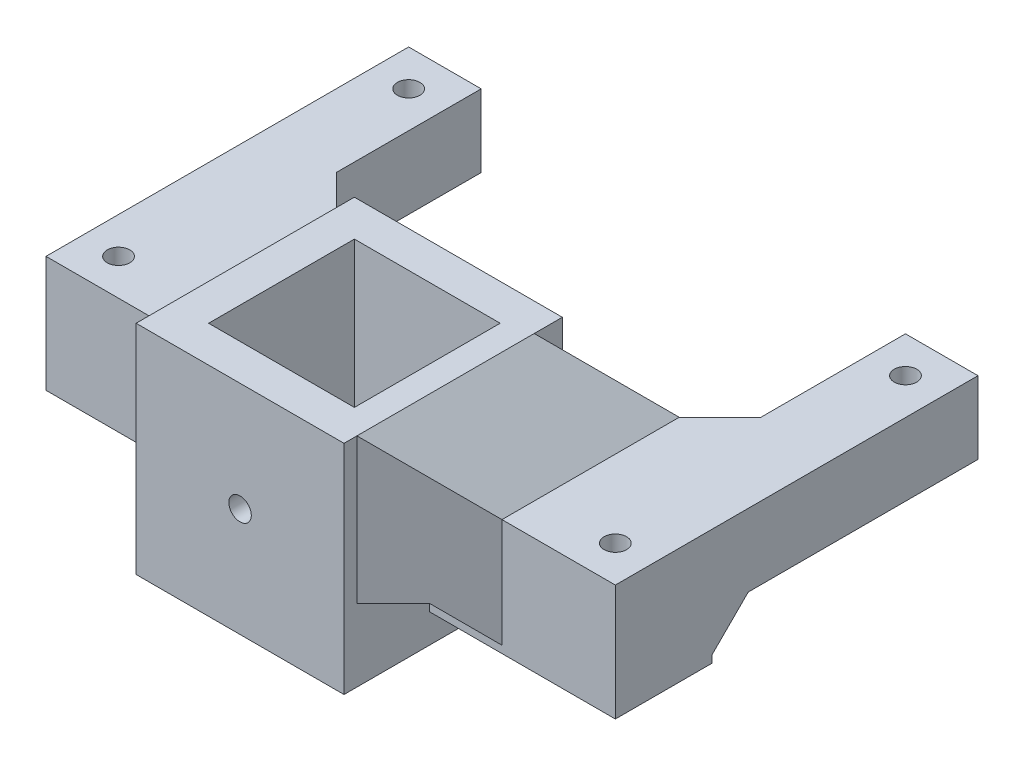
from build123d import *

# Parameters (mm, degrees)
BOSS_EXTRUDE3_START = 180
SKETCH2_R           = 1.55
SKETCH2_W           = 25.630091621
SKETCH2_H           = 13.32
BOSS_EXTRUDE3_DEPTH = 10
BOSS_EXTRUDE4_START = 170
BOSS_EXTRUDE4_DEPTH = 30
CHAMFER1_SIZE       = 10
CHAMFER2_SIZE       = 10
SKETCH3_R           = 1.55
CUT_EXTRUDE1_DEPTH  = 43
BOSS_EXTRUDE5_START = 174
SKETCH2_5_W         = 25.630091621
SKETCH2_5_H         = 13.32
SKETCH2_5_R         = 1.55
BOSS_EXTRUDE5_DEPTH = 6.1
CHAMFER3_SIZE       = 5


with BuildPart() as part:
    # Sketch2 → Boss-Extrude3 (new body)
    # profile 1 of 8: a face of its own
    with BuildSketch(Plane(origin=(0, 0, 0), x_dir=(1, 0, 0), z_dir=(0, 1, 0)).offset(BOSS_EXTRUDE3_START)):
        Polygon((-39.3, 56.78), (-49.3, 56.78), (-49.3, 20.1), (-25.1, 20.1), (-25.1, 22.65), (-39.3, 36.85), align=None)
        with Locations(Location((-44.3, 51.78, 0), (0, 0, 270))):
            Circle(SKETCH2_R, mode=Mode.SUBTRACT)
    # profile 2 of 8: a face of its own
    with BuildSketch(Plane(origin=(0, 0, 0), x_dir=(1, 0, 0), z_dir=(0, 1, 0)).offset(BOSS_EXTRUDE3_START)):
        Polygon((-25.1, 20.1), (-49.3, 20.1), (-49.3, 6.78), (-40, 6.78), (-25.1, 6.78), align=None)
        with Locations(Location((-44.3, 11.78, 0), (0, 0, 270))):
            Circle(SKETCH2_R, mode=Mode.SUBTRACT)
    # profile 3 of 8: a face of its own
    with BuildSketch(Plane(origin=(0, 0, 0), x_dir=(1, 0, 0), z_dir=(0, 1, 0)).offset(BOSS_EXTRUDE3_START)):
        Polygon((-20.1, 6.78), (-25.1, 6.78), (-25.1, -5), (3.569908379, -5), (3.569908379, 6.78), (0, 6.78), (0, 0), (-20.1, 0), align=None)
    # profile 4 of 8: a face of its own
    with BuildSketch(Plane(origin=(0, 0, 0), x_dir=(1, 0, 0), z_dir=(0, 1, 0)).offset(BOSS_EXTRUDE3_START)):
        Polygon((-25.1, 22.65), (-25.1, 20.1), (-25.1, 6.78), (-20.1, 6.78), (-20.1, 20.1), (-22.55, 20.1), align=None)
    # profile 5 of 8: a face of its own
    with BuildSketch(Plane(origin=(0, 0, 0), x_dir=(1, 0, 0), z_dir=(0, 1, 0)).offset(BOSS_EXTRUDE3_START)):
        Polygon((-25.1, 25.1), (-25.1, 22.65), (-22.55, 20.1), (-20.1, 20.1), (0, 20.1), (2.45, 20.1), (3.569908379, 21.219908379), (3.569908379, 25.1), align=None)
    # profile 6 of 8: a face of its own
    with BuildSketch(Plane(origin=(0, 0, 0), x_dir=(1, 0, 0), z_dir=(0, 1, 0)).offset(BOSS_EXTRUDE3_START)):
        Polygon((0, 20.1), (0, 6.78), (3.569908379, 6.78), (3.569908379, 20.1), (3.569908379, 21.219908379), (2.45, 20.1), align=None)
    # profile 7 of 8: a face of its own
    with BuildSketch(Plane(origin=(0, 0, 0), x_dir=(1, 0, 0), z_dir=(0, 1, 0)).offset(BOSS_EXTRUDE3_START)):
        with Locations((16.38495419, 13.44)):
            Rectangle(SKETCH2_W, SKETCH2_H)
        with Locations(Location((24.2, 11.78, 0), (0, 0, 270))):
            Circle(SKETCH2_R, mode=Mode.SUBTRACT)
    # profile 8 of 8: a face of its own
    with BuildSketch(Plane(origin=(0, 0, 0), x_dir=(1, 0, 0), z_dir=(0, 1, 0)).offset(BOSS_EXTRUDE3_START)):
        Polygon((19.2, 36.85), (3.569908379, 21.219908379), (3.569908379, 20.1), (29.2, 20.1), (29.2, 56.78), (19.2, 56.78), align=None)
        with Locations(Location((24.2, 51.78, 0), (0, 0, 270))):
            Circle(SKETCH2_R, mode=Mode.SUBTRACT)
    extrude(amount=BOSS_EXTRUDE3_DEPTH)

    # Sketch2<3> → Boss-Extrude4 (add)
    with BuildSketch(Plane(origin=(0, 0, 0), x_dir=(1, 0, 0), z_dir=(0, 1, 0)).offset(BOSS_EXTRUDE4_START)):
        Polygon((-25.1, 22.65), (-25.1, 20.1), (-25.1, 6.78), (-20.1, 6.78), (-20.1, 20.1), (-22.55, 20.1), align=None)
        Polygon((-25.1, 25.1), (-25.1, 22.65), (-22.55, 20.1), (-20.1, 20.1), (0, 20.1), (2.45, 20.1), (3.569908379, 21.219908379), (3.569908379, 25.1), align=None)
        Polygon((0, 20.1), (0, 6.78), (3.569908379, 6.78), (3.569908379, 20.1), (3.569908379, 21.219908379), (2.45, 20.1), align=None)
        Polygon((-20.1, 6.78), (-25.1, 6.78), (-25.1, -5), (3.569908379, -5), (3.569908379, 6.78), (0, 6.78), (0, 0), (-20.1, 0), align=None)
    extrude(amount=BOSS_EXTRUDE4_DEPTH)

    # Chamfer1
    chamfer1_edges = [part.edges().sort_by_distance(p)[0] for p in [
        (-25.1, 190, -14.715),
        (3.569908379, 190, -13.999954189),
    ]]
    chamfer(chamfer1_edges, length=CHAMFER1_SIZE - 0.0001)  # a hair under: the kernel refuses the full size

    # Chamfer2
    chamfer2_edges = [part.edges().sort_by_distance(p)[0] for p in [
        (3.569908379, 189.99995, -6.78),
        (-25.1, 189.99995, -6.78),
    ]]
    chamfer(chamfer2_edges, length=CHAMFER2_SIZE)

    # Sketch3 → Cut-Extrude1 (cut)
    with BuildSketch(Plane(origin=(0, 0, -25.1), x_dir=(-1, 0, 0), z_dir=(0, 0, -1))):
        with Locations((10.765045811, 185)):
            Circle(SKETCH3_R)
    extrude(amount=-CUT_EXTRUDE1_DEPTH, mode=Mode.SUBTRACT)

    # Sketch2<5> → Boss-Extrude5 (add)
    # profile 1 of 2: a face of its own
    with BuildSketch(Plane(origin=(0, 0, 0), x_dir=(1, 0, 0), z_dir=(0, 1, 0)).offset(BOSS_EXTRUDE5_START)):
        with Locations((16.38495419, 13.44)):
            Rectangle(SKETCH2_5_W, SKETCH2_5_H)
        with Locations(Location((24.2, 11.78, 0), (0, 0, 270))):
            Circle(SKETCH2_5_R, mode=Mode.SUBTRACT)
    # profile 2 of 2: a face of its own
    with BuildSketch(Plane(origin=(0, 0, 0), x_dir=(1, 0, 0), z_dir=(0, 1, 0)).offset(BOSS_EXTRUDE5_START)):
        Polygon((-25.1, 20.1), (-49.3, 20.1), (-49.3, 6.78), (-40, 6.78), (-25.1, 6.78), align=None)
        with Locations(Location((-44.3, 11.78, 0), (0, 0, 270))):
            Circle(SKETCH2_5_R, mode=Mode.SUBTRACT)
    extrude(amount=BOSS_EXTRUDE5_DEPTH)

    # Chamfer3
    chamfer3_edges = [part.edges().sort_by_distance(p)[0] for p in [
        (16.384954189, 180, -20.1),
        (8.569908379, 180, -6.78),
        (-30.1, 180, -6.78),
        (-37.2, 180, -20.1),
    ]]
    chamfer(chamfer3_edges, length=CHAMFER3_SIZE)


solid = part.part
